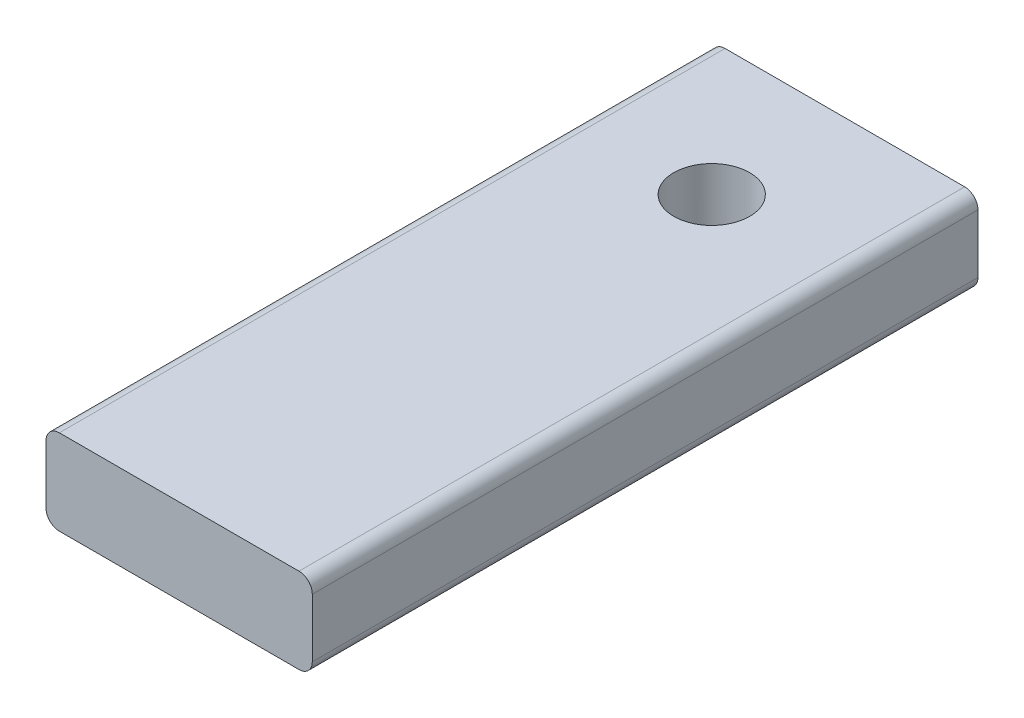
from build123d import *

# Parameters (mm, degrees)
BOSS_EXTRUDE1_DEPTH = 50
SKETCH2_R           = 2.85
CUT_EXTRUDE1_DEPTH  = 8


with BuildPart() as part:
    # Sketch1 → Boss-Extrude1 (new body)
    with BuildSketch(Plane.XY):
        with BuildLine():
            Line((-9, -3.2), (9, -3.2))
            ThreePointArc((9, -3.2), (9.707106781, -2.907106781), (10, -2.2))
            Line((10, -2.2), (10, 2.2))
            ThreePointArc((10, 2.2), (9.707106781, 2.907106781), (9, 3.2))
            Line((9, 3.2), (-9, 3.2))
            ThreePointArc((-9, 3.2), (-9.707106781, 2.907106781), (-10, 2.2))
            Line((-10, 2.2), (-10, -2.2))
            ThreePointArc((-10, -2.2), (-9.707106781, -2.907106781), (-9, -3.2))
        make_face()
    extrude(amount=BOSS_EXTRUDE1_DEPTH)

    # Sketch2 → Cut-Extrude1 (cut)
    with BuildSketch(Plane(origin=(0, -4, 0), x_dir=(1, 0, 0), z_dir=(0, 1, 0))):
        with Locations((0, -10)):
            Circle(SKETCH2_R)
    extrude(amount=CUT_EXTRUDE1_DEPTH, mode=Mode.SUBTRACT)


solid = part.part
